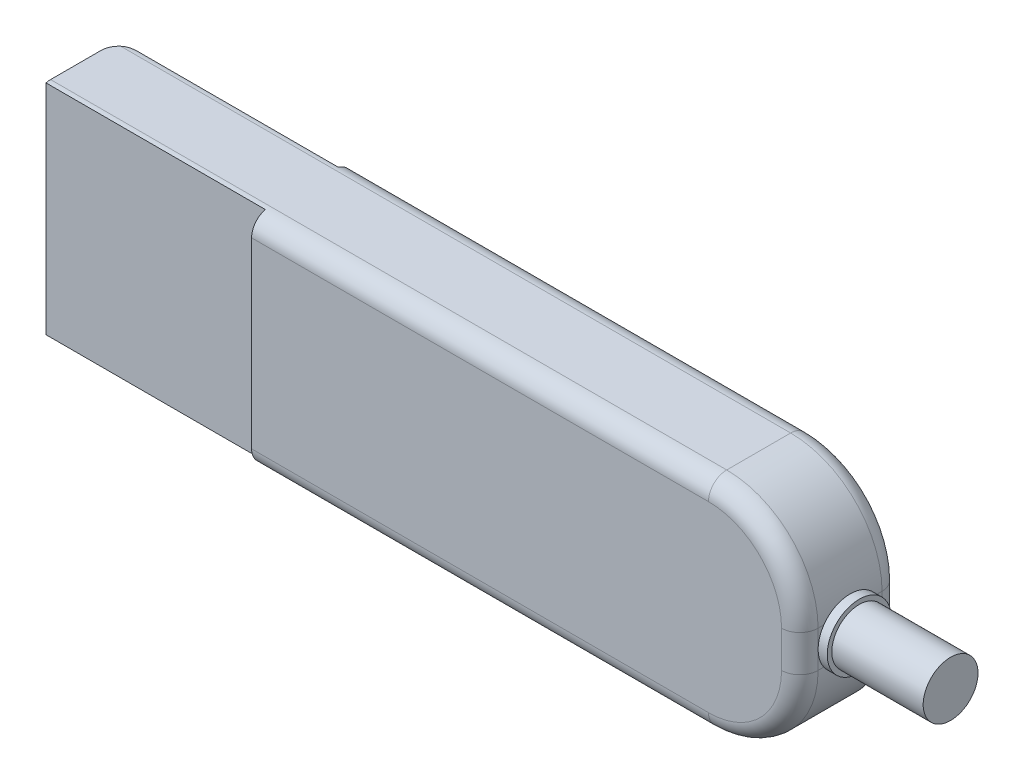
from build123d import *

# Parameters (mm, degrees)
BOSS_EXTRU_1_DEPTH      = 5.5
ESQUISSE6_W             = 12
ESQUISSE6_H             = 12
BOSS_EXTRU_4_DEPTH      = 4
ESQUISSE7_R             = 1.75
BOSS_EXTRU_7_DEPTH      = 0.5
ESQUISSE8_R             = 1.5
BOSS_EXTRU_9_DEPTH      = 5
CONG_1_R                = 1
CONG_2_R                = 1
CONG_3_R                = 1
ESQUISSE9_W             = 2
ESQUISSE9_H             = 11.5
ENL_V_MAT_EXTRU_1_DEPTH = 12


with BuildPart() as part:
    # Esquisse1 → Boss.-Extru.1 (new body)
    with BuildSketch(Plane.XY):
        with BuildLine():
            ThreePointArc((25, 12), (28.535533906, 10.535533906), (30, 7))
            Line((30, 7), (30, 5))
            ThreePointArc((30, 5), (28.535533906, 1.464466094), (25, 0))
            Line((25, 0), (0, 0))
            Line((0, 0), (0, 12))
            Line((0, 12), (25, 12))
        make_face()
    extrude(amount=BOSS_EXTRU_1_DEPTH)

    # Esquisse6 → Boss.-Extru.4 (add)
    with BuildSketch(Plane.XY.offset(0.75)):
        with Locations((-6, 6)):
            Rectangle(ESQUISSE6_W, ESQUISSE6_H)
    extrude(amount=BOSS_EXTRU_4_DEPTH)

    # Esquisse7 → Boss.-Extru.7 (add)
    with BuildSketch(Plane(origin=(30, 0, 0), x_dir=(0, 0, -1), z_dir=(1, 0, 0))):
        with Locations(Location((-2.75, 6, 0), (0, 0, 214.849904579))):
            Circle(ESQUISSE7_R)
    extrude(amount=BOSS_EXTRU_7_DEPTH)

    # Esquisse8 → Boss.-Extru.9 (add)
    with BuildSketch(Plane(origin=(30.5, 0, 0), x_dir=(0, 0, -1), z_dir=(1, 0, 0))):
        with Locations((-2.75, 6)):
            Circle(ESQUISSE8_R)
    extrude(amount=BOSS_EXTRU_9_DEPTH)

    # Congé1
    cong_1_edges = [part.edges().sort_by_distance(p)[0] for p in [
        (12.5, 0, 5.5),
        (28.535533906, 1.464466094, 5.5),
        (30, 6, 5.5),
        (28.535533906, 10.535533906, 5.5),
        (12.5, 12, 5.5),
    ]]
    fillet(cong_1_edges, radius=CONG_1_R - 0.0001)  # a hair under: the kernel refuses the full size

    # Congé2
    cong_2_edges = [part.edges().sort_by_distance(p)[0] for p in [
        (-12, 6, 0.75),
    ]]
    fillet(cong_2_edges, radius=CONG_2_R)

    # Congé3
    cong_3_edges = [part.edges().sort_by_distance(p)[0] for p in [
        (12.5, 0, 0),
        (28.535533906, 1.464466094, 0),
        (30, 6, 0),
        (28.535533906, 10.535533906, 0),
        (12.5, 12, 0),
    ]]
    fillet(cong_3_edges, radius=CONG_3_R - 0.0001)  # a hair under: the kernel refuses the full size

    # Esquisse9 → Enlèv. mat.-Extru.1 (cut)
    with BuildSketch(Plane.ZY.offset(12)):
        with Locations((3.25, 6)):
            Rectangle(ESQUISSE9_W, ESQUISSE9_H)
    extrude(amount=-ENL_V_MAT_EXTRU_1_DEPTH, mode=Mode.SUBTRACT)


solid = part.part
